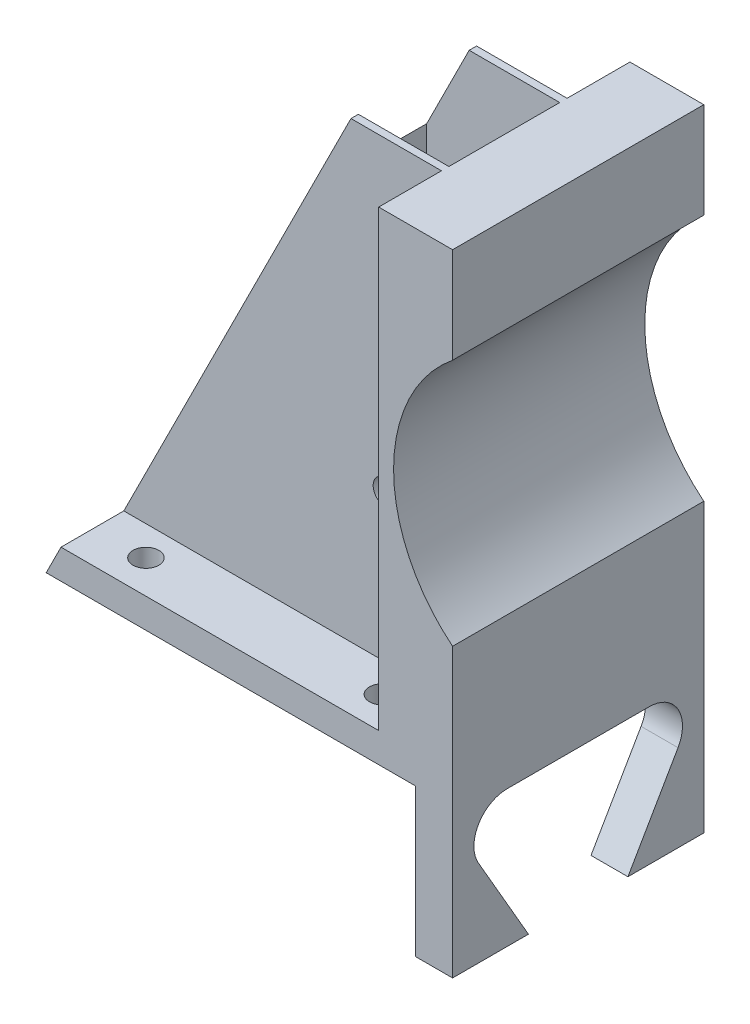
from build123d import *

# Parameters (mm, degrees)
BOSS_EXTRUDE2_DEPTH = 34
SKETCH5_W           = 50
SKETCH5_H           = 20
CUT_EXTRUDE1_DEPTH  = 8.5
SKETCH6_W           = 50
SKETCH6_H           = 20
CUT_EXTRUDE2_DEPTH  = 8.5
SKETCH7_W           = 52.006330756
SKETCH7_H           = 21.627895193
CUT_EXTRUDE3_DEPTH  = 86.026964934
CUT_EXTRUDE4_DEPTH  = 100.299218355
SKETCH10_R          = 1.75
CUT_EXTRUDE5_DEPTH  = 10
SKETCH14_W          = 15
SKETCH14_H          = 37
CUT_EXTRUDE8_DEPTH  = 18
SKETCH15_W          = 18
SKETCH15_H          = 15
CUT_EXTRUDE9_DEPTH  = 9
SKETCH16_W          = 13
SKETCH16_H          = 9
CUT_EXTRUDE10_DEPTH = 95.129351245
SKETCH17_R          = 1.75
CUT_EXTRUDE11_DEPTH = 86.026964934


with BuildPart() as part:
    # Sketch4 → Boss-Extrude2 (new body)
    with BuildSketch(Plane.XY):
        with BuildLine():
            Line((-25, -10), (30, -10))
            Line((30, -10), (30, 28.879361226))
            ThreePointArc((30, 28.879361226), (22.015013929, 45.643361226), (30, 62.407361226))
            Line((30, 62.407361226), (30, 75.361361226))
            Line((30, 75.361361226), (7.747226033, 75.361361226))
            Line((7.747226033, 75.361361226), (-25, 10))
            Line((-25, 10), (-25, -10))
        make_face()
    extrude(amount=BOSS_EXTRUDE2_DEPTH)

    # Sketch5 → Cut-Extrude1 (cut)
    with BuildSketch(Plane.XY.offset(34)):
        Polygon((-22.995927538, 14), (7.747226033, 75.361361226), (20, 75.361361226), (20, 14), align=None)
        Rectangle(SKETCH5_W, SKETCH5_H)
    extrude(amount=-CUT_EXTRUDE1_DEPTH, mode=Mode.SUBTRACT)

    # Sketch6 → Cut-Extrude2 (cut)
    with BuildSketch(Plane(origin=(0, 0, 0), x_dir=(-1, 0, 0), z_dir=(0, 0, -1))):
        Polygon((22.995927538, 14), (-20, 14), (-20, 75.361361226), (-7.747226033, 75.361361226), align=None)
        Rectangle(SKETCH6_W, SKETCH6_H)
    extrude(amount=-CUT_EXTRUDE2_DEPTH, mode=Mode.SUBTRACT)

    # Sketch7 → Cut-Extrude3 (cut, through all)
    with BuildSketch(Plane(origin=(0, 0, 8.5), x_dir=(-1, 0, 0), z_dir=(0, 0, -1))):
        with Locations((1.003165378, -0.813947597)):
            Rectangle(SKETCH7_W, SKETCH7_H)
    extrude(amount=-CUT_EXTRUDE3_DEPTH, mode=Mode.SUBTRACT)

    # Sketch9 → Cut-Extrude4 (cut, through all)
    with BuildSketch(Plane(origin=(30, 0, 0), x_dir=(0, 0, -1), z_dir=(1, 0, 0))):
        with BuildLine():
            Line((-26.615, 8.489680613), (-7.385, 8.489680613))
            ThreePointArc((-7.385, 8.489680613), (-3.487778361, 6.239494716), (-3.488100353, 1.739308835))
            Line((-3.488100353, 1.739308835), (-13.103100353, -14.910691165))
            ThreePointArc((-13.103100353, -14.910691165), (-17, -17.160319387), (-20.896899647, -14.910691165))
            Line((-20.896899647, -14.910691165), (-30.511899647, 1.739308835))
            ThreePointArc((-30.511899647, 1.739308835), (-30.512221639, 6.239494716), (-26.615, 8.489680613))
        make_face()
    extrude(amount=-CUT_EXTRUDE4_DEPTH, mode=Mode.SUBTRACT)

    # Sketch10 → Cut-Extrude5 (cut)
    with BuildSketch(Plane.XZ.offset(-10)):
        with Locations((16, 29.5)):
            Circle(SKETCH10_R)
        with Locations((16, 4.5)):
            Circle(SKETCH10_R)
        with Locations((-16, 29.5)):
            Circle(SKETCH10_R)
        with Locations((-16, 4.5)):
            Circle(SKETCH10_R)
    extrude(amount=-CUT_EXTRUDE5_DEPTH, mode=Mode.SUBTRACT)

    # Sketch14 → Cut-Extrude8 (cut)
    with BuildSketch(Plane.ZY.offset(-20)):
        with Locations((17, 56.861361226)):
            Rectangle(SKETCH14_W, SKETCH14_H)
    extrude(amount=CUT_EXTRUDE8_DEPTH, mode=Mode.SUBTRACT)

    # Sketch15 → Cut-Extrude9 (cut)
    with BuildSketch(Plane(origin=(0, 38.361361226, 0), x_dir=(1, 0, 0), z_dir=(0, 1, 0))):
        with Locations((11, -17)):
            Rectangle(SKETCH15_W, SKETCH15_H)
    extrude(amount=-CUT_EXTRUDE9_DEPTH, mode=Mode.SUBTRACT)

    # Sketch16 → Cut-Extrude10 (cut, through all)
    with BuildSketch(Plane.ZY.offset(-20)):
        with Locations((17, 33.861361226)):
            Rectangle(SKETCH16_W, SKETCH16_H)
    extrude(amount=CUT_EXTRUDE10_DEPTH, mode=Mode.SUBTRACT)

    # Sketch17 → Cut-Extrude11 (cut, through all)
    with BuildSketch(Plane.XY.offset(25.5)):
        with Locations((12.5, 33.861361226)):
            Circle(SKETCH17_R)
    extrude(amount=-CUT_EXTRUDE11_DEPTH, mode=Mode.SUBTRACT)


solid = part.part
